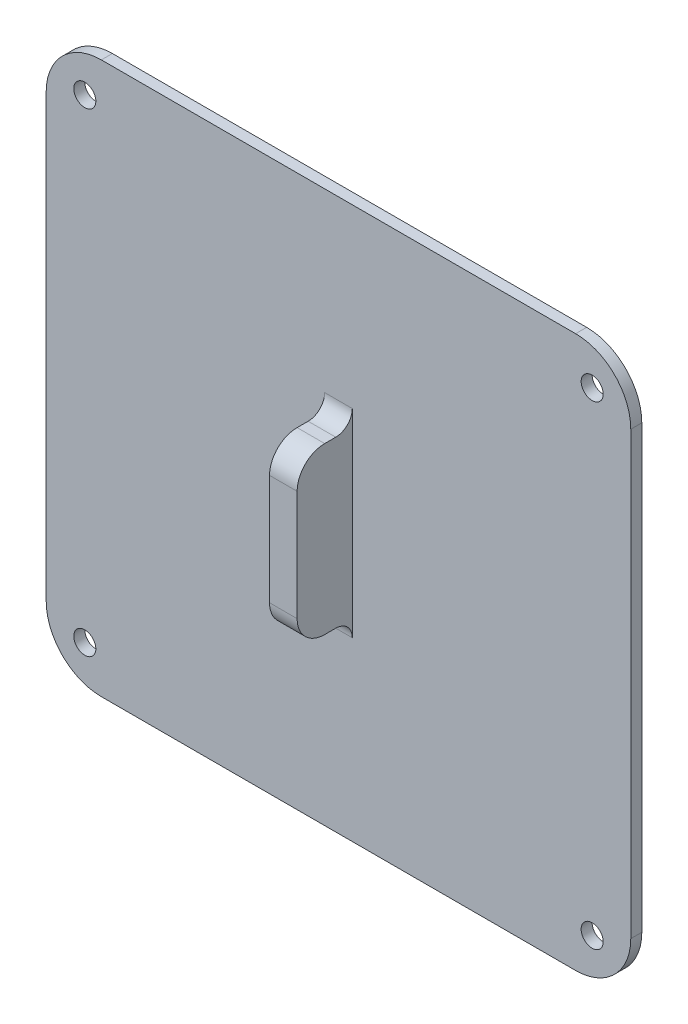
from build123d import *

# Parameters (mm, degrees)
BOSS_EXTRUDE1_DEPTH = 2
SKETCH2_R           = 2
CUT_EXTRUDE1_DEPTH  = 3
SKETCH6_W           = 5
SKETCH6_H           = 30
BOSS_EXTRUDE2_DEPTH = 10
FILLET1_R           = 5
FILLET2_R           = 3


with BuildPart() as part:
    # Sketch1 → Boss-Extrude1 (new body)
    with BuildSketch(Plane.XY):
        with BuildLine():
            Line((-43, 260), (43, 260))
            ThreePointArc((43, 260), (50.071067812, 262.928932188), (53, 270))
            Line((53, 270), (53, 350))
            ThreePointArc((53, 350), (50.071067812, 357.071067812), (43, 360))
            Line((43, 360), (-43, 360))
            ThreePointArc((-43, 360), (-50.071067812, 357.071067812), (-53, 350))
            Line((-53, 350), (-53, 270))
            ThreePointArc((-53, 270), (-50.071067812, 262.928932188), (-43, 260))
        make_face()
    extrude(amount=-BOSS_EXTRUDE1_DEPTH)

    # Sketch2 → Cut-Extrude1 (cut)
    with BuildSketch(Plane(origin=(0, 0, -2), x_dir=(-1, 0, 0), z_dir=(0, 0, -1))):
        with Locations((46, 267)):
            Circle(SKETCH2_R)
        with Locations((-46, 267)):
            Circle(SKETCH2_R)
        with Locations((-46, 353)):
            Circle(SKETCH2_R)
        with Locations((46, 353)):
            Circle(SKETCH2_R)
    extrude(amount=-CUT_EXTRUDE1_DEPTH, mode=Mode.SUBTRACT)

    # Sketch6 → Boss-Extrude2 (add)
    with BuildSketch(Plane.XY):
        with Locations((0, 310)):
            Rectangle(SKETCH6_W, SKETCH6_H)
    extrude(amount=BOSS_EXTRUDE2_DEPTH)

    # Fillet1
    fillet1_edges = [part.edges().sort_by_distance(p)[0] for p in [
        (0, 325, 10),
        (0, 295, 10),
    ]]
    fillet(fillet1_edges, radius=FILLET1_R)

    # Fillet2
    fillet2_edges = [part.edges().sort_by_distance(p)[0] for p in [
        (0, 295, 0),
        (0, 325, 0),
    ]]
    fillet(fillet2_edges, radius=FILLET2_R)


solid = part.part
